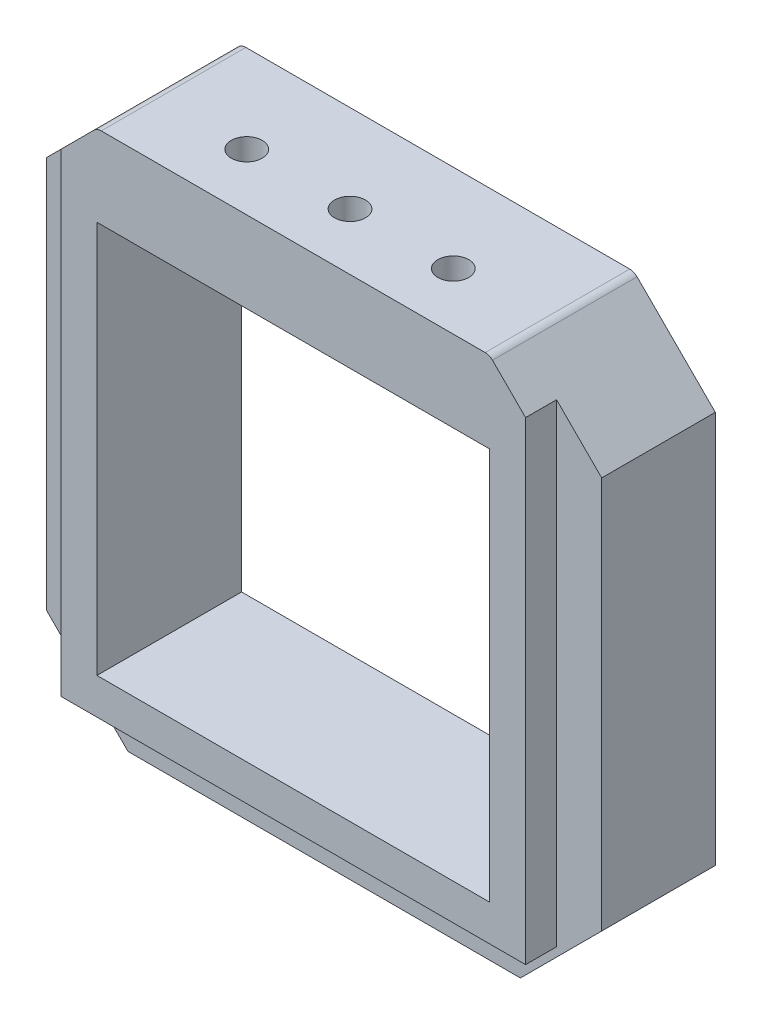
from build123d import *

# Parameters (mm, degrees)
CROQUIS3_W                   = 38
CROQUIS3_H                   = 38
SALIENTE_EXTRUIR9_DEPTH      = 1
SALIENTE_EXTRUIR10_START     = -11
SALIENTE_EXTRUIR10_OUTLINE_W = 38
SALIENTE_EXTRUIR10_OUTLINE_H = 38
SALIENTE_EXTRUIR10_DEPTH     = 10
REDONDEO3_R                  = 1
CROQUIS13_W                  = 38
CROQUIS13_H                  = 38
SALIENTE_EXTRUIR15_DEPTH     = 3
CROQUIS15_R                  = 1.5
CORTAR_EXTRUIR5_DEPTH        = 5


# Read off the part's stored shape, not the designer's step: Saliente-Extruir10
with BuildPart() as part:
    # Croquis3 → Saliente-Extruir9 (new body)
    with BuildSketch(Plane.XY.offset(5)):
        Polygon((19, -5.370057685), (26.870057685, 2.5), (26.870057685, 40.5), (19, 48.370057685), (-19, 48.370057685), (-26.870057685, 40.5), (-26.870057685, 2.5), (-19, -5.370057685), align=None)
        with Locations((0, 21.5)):
            Rectangle(CROQUIS3_W, CROQUIS3_H, mode=Mode.SUBTRACT)
    extrude(amount=-SALIENTE_EXTRUIR9_DEPTH)

    # Saliente-Extruir10 outline → Saliente-Extruir10 (add)
    with BuildSketch(Plane(origin=(0, 0, 4), x_dir=(-1, 0, 0), z_dir=(0, 0, -1)).offset(SALIENTE_EXTRUIR10_START)):
        Polygon((-26.870057685, 2.5), (-19, -5.370057685), (19, -5.370057685), (26.870057685, 2.5), (26.870057685, 40.5), (19, 48.370057685), (-19, 48.370057685), (-26.870057685, 40.5), align=None)
        with Locations((0, 21.5)):
            Rectangle(SALIENTE_EXTRUIR10_OUTLINE_W, SALIENTE_EXTRUIR10_OUTLINE_H, mode=Mode.SUBTRACT)
    extrude(amount=SALIENTE_EXTRUIR10_DEPTH)

    # Redondeo3
    redondeo3_edges = [part.edges().sort_by_distance(p)[0] for p in [
        (-19, 48.370057685, 10),
        (19, 48.370057685, 10),
    ]]
    fillet(redondeo3_edges, radius=REDONDEO3_R)

    # Croquis13 → Saliente-Extruir15 (add)
    with BuildSketch(Plane.XY.offset(15)):
        with BuildLine():
            Line((-22.5, 44.870057685), (-22.5, -1))
            Line((-22.5, -1), (22.5, -1))
            Line((22.5, -1), (22.5, 44.870057685))
            Line((22.5, 44.870057685), (19.292893219, 48.077164466))
            ThreePointArc((19.292893219, 48.077164466), (18.96846987, 48.293937218), (18.585786438, 48.370057685))
            Line((18.585786438, 48.370057685), (-18.585786438, 48.370057685))
            ThreePointArc((-18.585786438, 48.370057685), (-18.96846987, 48.293937218), (-19.292893219, 48.077164466))
            Line((-19.292893219, 48.077164466), (-22.5, 44.870057685))
        make_face()
        with Locations((0, 21.5)):
            Rectangle(CROQUIS13_W, CROQUIS13_H, mode=Mode.SUBTRACT)
    extrude(amount=SALIENTE_EXTRUIR15_DEPTH)

    # Croquis15 → Cortar-Extruir5 (cut)
    with BuildSketch(Plane(origin=(0, 48.370057685, 0), x_dir=(1, 0, 0), z_dir=(0, 1, 0))):
        with Locations(Location((0, -12.5, 0), (0, 0, 270))):
            Circle(CROQUIS15_R)
        with Locations(Location((-10, -12.5, 0), (0, 0, 270))):
            Circle(CROQUIS15_R)
        with Locations(Location((10, -12.5, 0), (0, 0, 90))):
            Circle(CROQUIS15_R)
    extrude(amount=-CORTAR_EXTRUIR5_DEPTH, mode=Mode.SUBTRACT)


solid = part.part
